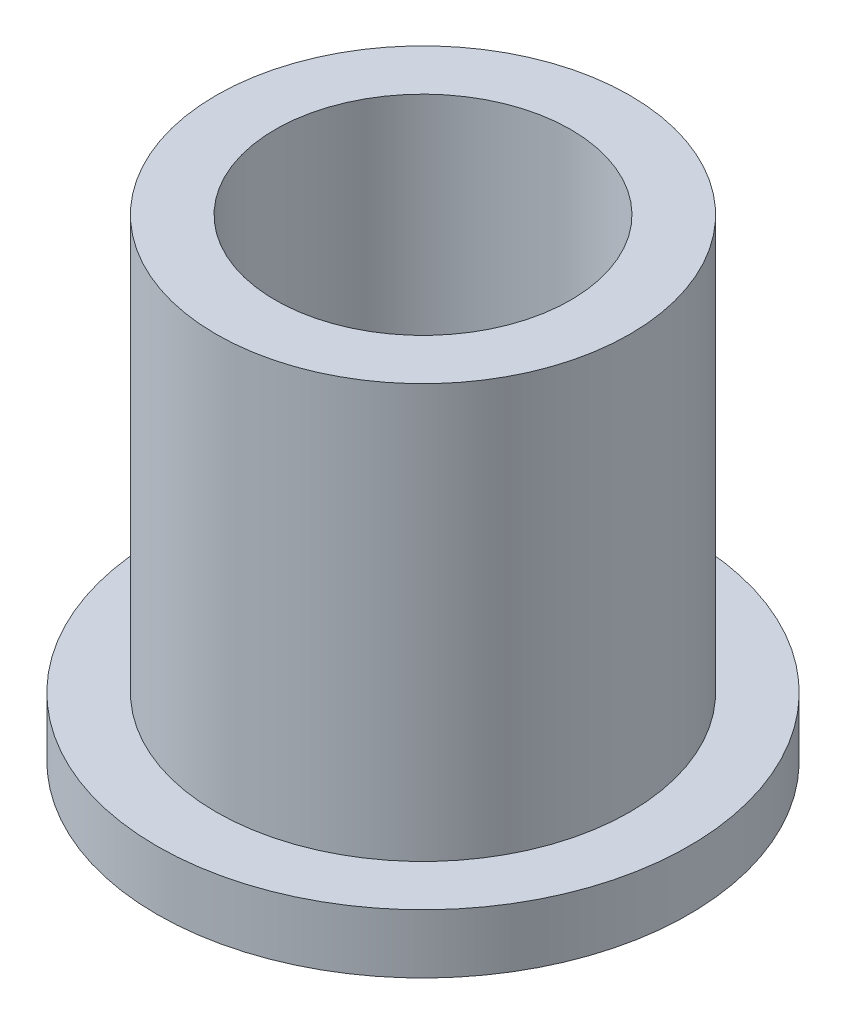
from build123d import *


with BuildPart() as part:
    # Sketch1 → Revolve1 (revolve)
    with BuildSketch(Plane.XY):
        Polygon((3.96875, 0), (7.14375, 0), (7.14375, 1.5875), (5.55625, 1.5875), (5.55625, 12.7), (3.96875, 12.7), align=None)
    revolve(axis=Axis((0, 0, 0), (0, 1, 0)))


solid = part.part
